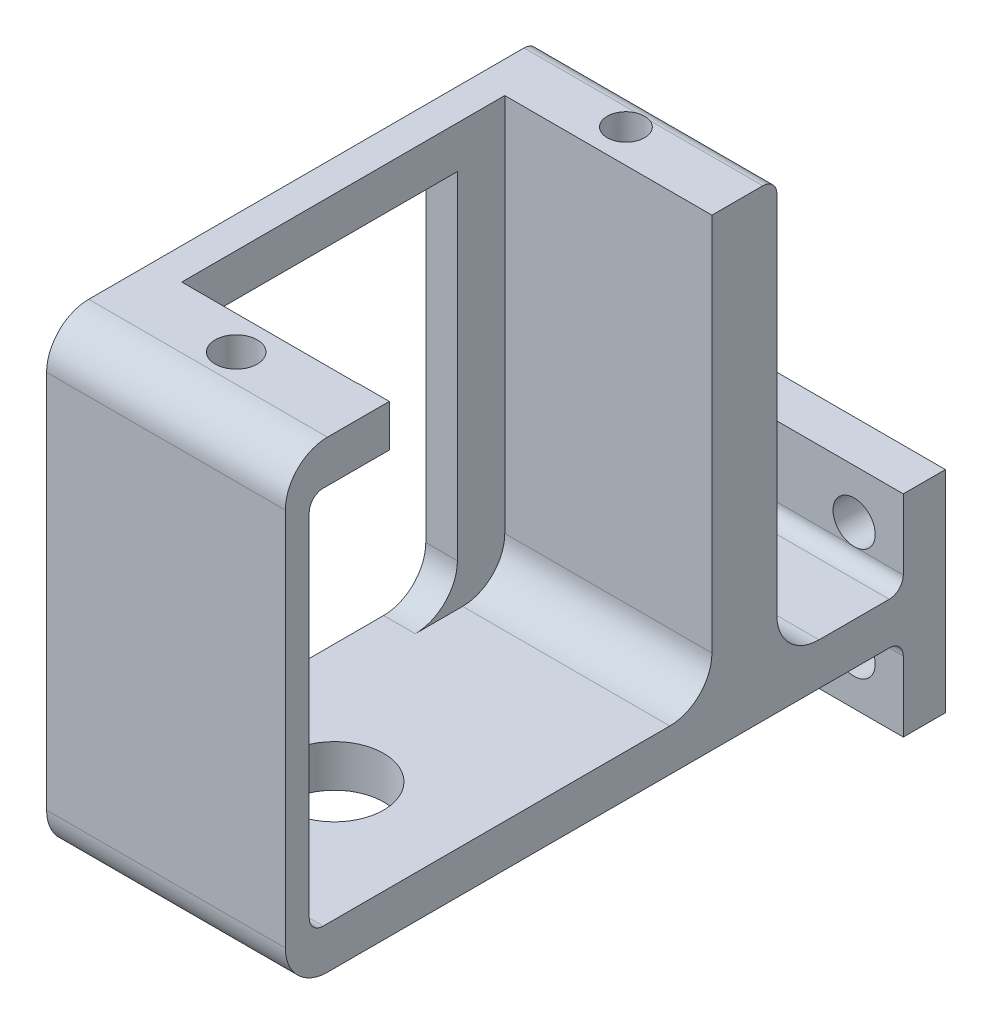
from build123d import *

# Parameters (mm, degrees)
SKETCH1_W           = 17
SKETCH1_H           = 47
SKETCH1_R           = 3.5
BOSS_EXTRUDE1_DEPTH = 3
SKETCH2_W           = 17
SKETCH2_H           = 8
SKETCH2_H_2         = 1.7
BOSS_EXTRUDE2_DEPTH = 27
SKETCH3_W           = 17
SKETCH3_H           = 35
BOSS_EXTRUDE3_DEPTH = 3
SKETCH4_R           = 3.5
CUT_EXTRUDE1_DEPTH  = 3
SKETCH5_R           = 1.5
SKETCH5_R_2         = 1.331036909
CUT_EXTRUDE2_DEPTH  = 15
SKETCH7_W           = 12.5
SKETCH7_H           = 23
CUT_EXTRUDE3_DEPTH  = 30
SKETCH8_W           = 17
SKETCH8_H           = 15
SKETCH8_R           = 1.5
BOSS_EXTRUDE4_DEPTH = 3
SKETCH9_W           = 2.25
SKETCH9_H           = 22.972634834
CUT_EXTRUDE4_DEPTH  = 30
FILLET8_R           = 3
FILLET9_R           = 3
FILLET10_R          = 3
FILLET11_R          = 3
FILLET12_R          = 3
FILLET13_START      = -2.737421384
FILLET13_DEPTH      = 17
FILLET14_START      = -2.737421384
FILLET14_DEPTH      = 17
FILLET15_R          = 1
FILLET16_R          = 1
FILLET17_R          = 1


with BuildPart() as part:
    # Sketch1 → Boss-Extrude1 (new body)
    with BuildSketch(Plane(origin=(0, 0, 0), x_dir=(1, 0, 0), z_dir=(0, 1, 0))):
        with Locations((5.762578616, -2.364779874)):
            Rectangle(SKETCH1_W, SKETCH1_H)
        with Locations(Location((5.762578616, -13.864779874, 0), (0, 0, 270))):
            Circle(SKETCH1_R, mode=Mode.SUBTRACT)
    extrude(amount=BOSS_EXTRUDE1_DEPTH)

    # Sketch2 → Boss-Extrude2 (add)
    with BuildSketch(Plane(origin=(0, 3, 0), x_dir=(1, 0, 0), z_dir=(0, 1, 0))):
        with Locations((5.762578616, 5.135220126)):
            Rectangle(SKETCH2_W, SKETCH2_H)
        with Locations((5.762578616, -25.014779874)):
            Rectangle(SKETCH2_W, SKETCH2_H_2)
    extrude(amount=BOSS_EXTRUDE2_DEPTH)

    # Sketch3 → Boss-Extrude3 (add)
    with BuildSketch(Plane(origin=(0, 30, 0), x_dir=(1, 0, 0), z_dir=(0, 1, 0))):
        with Locations((5.762578616, -8.364779874)):
            Rectangle(SKETCH3_W, SKETCH3_H)
    extrude(amount=BOSS_EXTRUDE3_DEPTH)

    # Sketch4 → Cut-Extrude1 (cut)
    with BuildSketch(Plane.XZ.offset(-30)):
        with Locations(Location((5.762578616, 13.864779874, 0), (0, 0, 90))):
            Circle(SKETCH4_R)
    extrude(amount=-CUT_EXTRUDE1_DEPTH, mode=Mode.SUBTRACT)

    # Sketch5 → Cut-Extrude2 (cut)
    with BuildSketch(Plane(origin=(0, 33, 0), x_dir=(1, 0, 0), z_dir=(0, 1, 0))):
        with Locations(Location((5.762578616, -20.864779874, 0), (0, 0, 270))):
            Circle(SKETCH5_R)
        with Locations(Location((5.762578616, 6.885220126, 0), (0, 0, 270))):
            Circle(SKETCH5_R_2)
    extrude(amount=-CUT_EXTRUDE2_DEPTH, mode=Mode.SUBTRACT)

    # Sketch7 → Cut-Extrude3 (cut)
    with BuildSketch(Plane(origin=(0, 33, 0), x_dir=(1, 0, 0), z_dir=(0, 1, 0))):
        with Locations((5.762578616, -6.989779874)):
            Rectangle(SKETCH7_W, SKETCH7_H)
    extrude(amount=-CUT_EXTRUDE3_DEPTH, mode=Mode.SUBTRACT)

    # Sketch8 → Boss-Extrude4 (add)
    with BuildSketch(Plane(origin=(0, 0, -21.135220126), x_dir=(-1, 0, 0), z_dir=(0, 0, -1))):
        with Locations((-5.762578616, 1.5)):
            Rectangle(SKETCH8_W, SKETCH8_H)
        with Locations((-10.762578616, 5.5)):
            Circle(SKETCH8_R, mode=Mode.SUBTRACT)
        with Locations((-0.762578616, 5.5)):
            Circle(SKETCH8_R, mode=Mode.SUBTRACT)
        with Locations((-10.762578616, -2.5)):
            Circle(SKETCH8_R, mode=Mode.SUBTRACT)
        with Locations((-0.762578616, -2.5)):
            Circle(SKETCH8_R, mode=Mode.SUBTRACT)
    extrude(amount=-BOSS_EXTRUDE4_DEPTH)

    # Sketch9 → Cut-Extrude4 (cut)
    with BuildSketch(Plane(origin=(0, 33, 0), x_dir=(1, 0, 0), z_dir=(0, 1, 0))):
        with Locations((13.137578616, -6.976097291)):
            Rectangle(SKETCH9_W, SKETCH9_H)
    extrude(amount=-CUT_EXTRUDE4_DEPTH, mode=Mode.SUBTRACT)

    # Fillet8
    fillet8_edges = [part.edges().sort_by_distance(p)[0] for p in [
        (5.762578616, 0, 25.864779874),
    ]]
    fillet(fillet8_edges, radius=FILLET8_R)

    # Fillet9
    fillet9_edges = [part.edges().sort_by_distance(p)[0] for p in [
        (5.762578616, 33, 25.864779874),
    ]]
    fillet(fillet9_edges, radius=FILLET9_R)

    # Fillet10
    fillet10_edges = [part.edges().sort_by_distance(p)[0] for p in [
        (5.762578616, 3, -9.135220126),
    ]]
    fillet(fillet10_edges, radius=FILLET10_R)

    # Fillet11
    fillet11_edges = [part.edges().sort_by_distance(p)[0] for p in [
        (6.887578616, 3, -4.510220126),
    ]]
    fillet(fillet11_edges, radius=FILLET11_R)

    # Fillet12
    fillet12_edges = [part.edges().sort_by_distance(p)[0] for p in [
        (-1.612421384, 3, -1.135220126),
    ]]
    fillet(fillet12_edges, radius=FILLET12_R)

    # Fillet13: read off the stored shape, not the designer's step
    # Fillet13 outline → Fillet13 (add)
    with BuildSketch(Plane.YZ.offset(FILLET13_START)):
        with BuildLine():
            Line((3, -18.135220126), (4, -18.135220126))
            ThreePointArc((4, -18.135220126), (3.292893219, -17.842326907), (3, -17.135220126))
            Line((3, -17.135220126), (3, -18.135220126))
        make_face()
    extrude(amount=FILLET13_DEPTH)

    # Fillet14: read off the stored shape, not the designer's step
    # Fillet14 outline → Fillet14 (add)
    with BuildSketch(Plane.YZ.offset(FILLET14_START)):
        with BuildLine():
            ThreePointArc((0, -17.135220126), (-0.292893219, -17.842326907), (-1, -18.135220126))
            Line((-1, -18.135220126), (0, -18.135220126))
            Line((0, -18.135220126), (0, -17.135220126))
        make_face()
    extrude(amount=FILLET14_DEPTH)

    # Fillet15
    fillet15_edges = [part.edges().sort_by_distance(p)[0] for p in [
        (5.762578616, 3, 24.164779874),
    ]]
    fillet(fillet15_edges, radius=FILLET15_R)

    # Fillet16
    fillet16_edges = [part.edges().sort_by_distance(p)[0] for p in [
        (5.762578616, 30, 24.164779874),
    ]]
    fillet(fillet16_edges, radius=FILLET16_R)

    # Fillet17
    # the kernel refuses this fillet: 1 mm, written as the material it takes off along each edge
    with BuildSketch(Plane(origin=(-5.237421384, 33, -9.135220126), x_dir=(0, -1, 0), z_dir=(1, 0, 0))) as fillet17_piece_1:
        with BuildLine():
            CenterArc((FILLET17_R, -FILLET17_R), FILLET17_R, 90, 90)
            Line((0, -FILLET17_R), (0, 0))
            Line((0, 0), (FILLET17_R, 0))
        make_face()
    extrude(amount=22, mode=Mode.SUBTRACT)


solid = part.part
